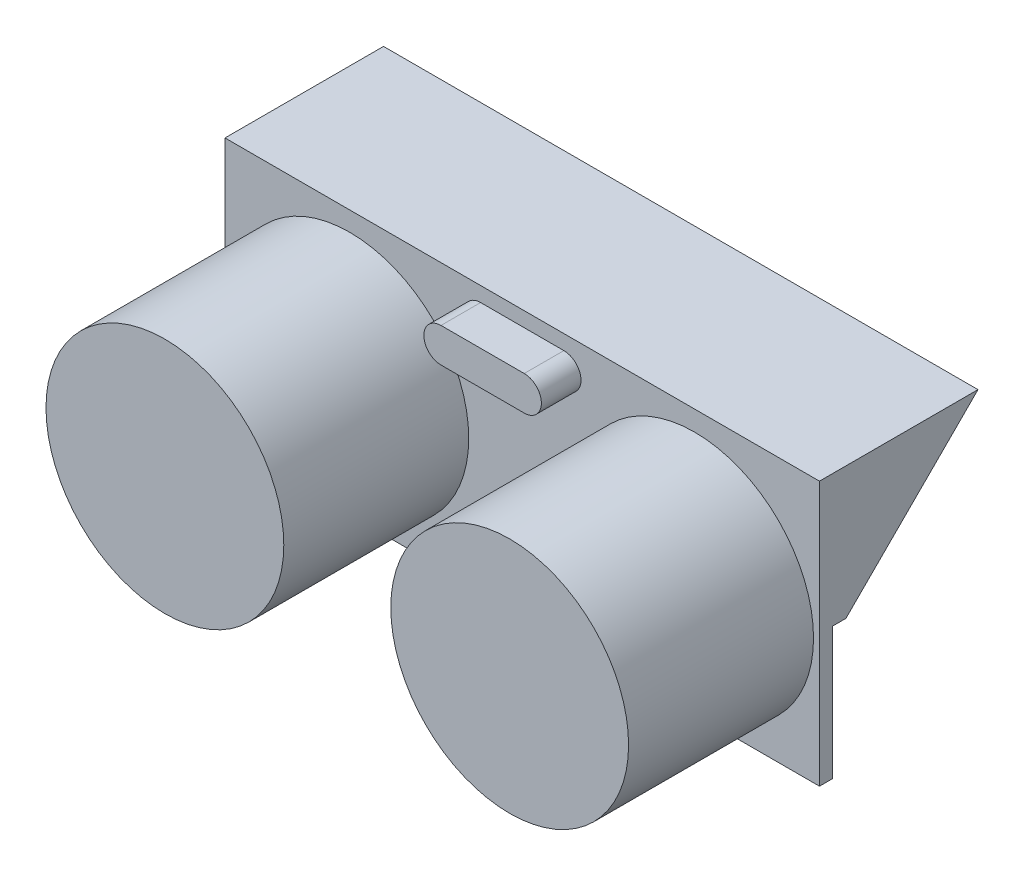
from build123d import *

# Parameters (mm, degrees)
ESQUISSE1_W             = 45
ESQUISSE1_H             = 20
BOSS_EXTRU_1_DEPTH      = 1
ESQUISSE2_R             = 9
BOSS_EXTRU_3_DEPTH      = 14
BOSS_EXTRU_4_DEPTH      = 3
BOSS_EXTRU_5_DEPTH      = 6
BOSS_EXTRU_5_DEPTH_BACK = 1.5
SKETCH3_W               = 45
SKETCH3_H               = 10
BOSS_EXTRUDE1_DEPTH     = 12
CHAMFER1_SIZE           = 11


with BuildPart() as part:
    # Esquisse1 → Boss.-Extru.1 (new body)
    with BuildSketch(Plane.XY):
        with Locations((-4.778042712, 5.919811321)):
            Rectangle(ESQUISSE1_W, ESQUISSE1_H)
    extrude(amount=BOSS_EXTRU_1_DEPTH)

    # Esquisse2 → Boss.-Extru.3 (add)
    with BuildSketch(Plane.XY.offset(1)):
        with Locations((-17.828042712, 5.456465128)):
            Circle(ESQUISSE2_R)
        with Locations((8.271957288, 5.410130508)):
            Circle(ESQUISSE2_R)
    extrude(amount=BOSS_EXTRU_3_DEPTH)

    # Esquisse3 → Boss.-Extru.4 (add)
    with BuildSketch(Plane.XY.offset(1)):
        with BuildLine():
            Line((-7.928796825, 14.80247516), (-1.627288599, 14.80247516))
            ThreePointArc((-1.627288599, 14.80247516), (-0.329919258, 13.505105819), (-1.627288599, 12.207736479))
            Line((-1.627288599, 12.207736479), (-7.928796825, 12.207736479))
            ThreePointArc((-7.928796825, 12.207736479), (-9.226166166, 13.505105819), (-7.928796825, 14.80247516))
        make_face()
    extrude(amount=BOSS_EXTRU_4_DEPTH)

    # Esquisse4 → Boss.-Extru.5 (add, two sides: drawn at the far end of the back side and taken through both)
    with BuildSketch(Plane(origin=(0.9463019, -1.208788393, 0), x_dir=(-1, 0, 0), z_dir=(0, 0, -1)).offset(-BOSS_EXTRU_5_DEPTH_BACK)):
        with BuildLine():
            Line((2.572836386, 0.424993111), (8.874344612, 0.424993111))
            ThreePointArc((8.874344612, 0.424993111), (10.17073801, -0.871400286), (8.874344612, -2.167793683))
            Line((8.874344612, -2.167793683), (2.572836386, -2.167793683))
            ThreePointArc((2.572836386, -2.167793683), (1.276442989, -0.871400286), (2.572836386, 0.424993111))
        make_face()
    extrude(amount=BOSS_EXTRU_5_DEPTH + BOSS_EXTRU_5_DEPTH_BACK)

    # Sketch3 → Boss-Extrude1 (add)
    with BuildSketch(Plane(origin=(0, 0, 0), x_dir=(-1, 0, 0), z_dir=(0, 0, -1))):
        with Locations((4.778042712, 10.919811321)):
            Rectangle(SKETCH3_W, SKETCH3_H)
    extrude(amount=BOSS_EXTRUDE1_DEPTH)

    # Chamfer1
    # the kernel refuses this chamfer: 11 mm, written as the material it takes off along each edge
    with BuildSketch(Plane(origin=(-55.56655558, 5.919811321, -12), x_dir=(0, 0.9996219169112968, -0.027495876610586417), z_dir=(1, 0, 0))) as chamfer1_piece_1:
        Polygon((CHAMFER1_SIZE * 0.999621916911, CHAMFER1_SIZE * 0.0274958766106), (-CHAMFER1_SIZE * 0.0274958766106, CHAMFER1_SIZE * 0.999621916911), (0, 0), align=None)
    extrude(amount=101.577025735, mode=Mode.SUBTRACT)


solid = part.part
